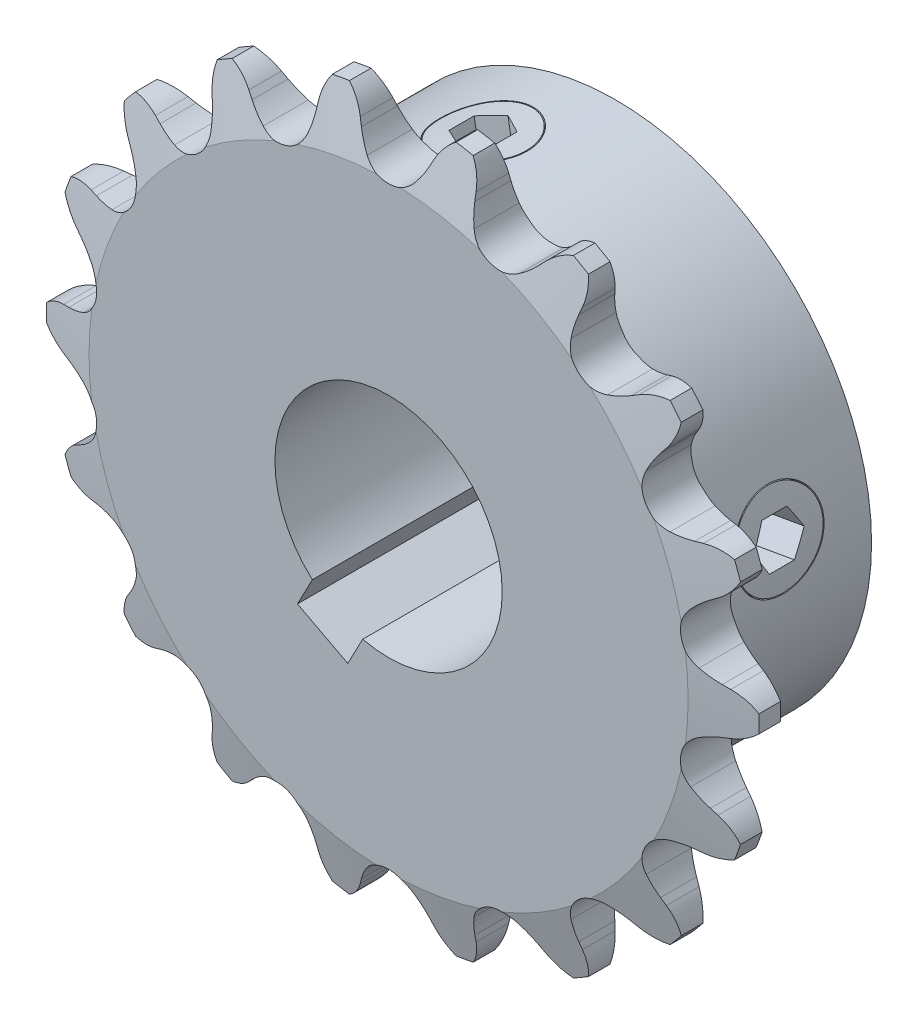
from build123d import *

# Parameters (mm, degrees)
TOOTH_CUT_NUMBER_OF_TEETH_18_DEPTH = 29.19349073
TOOTH_PATTERN_18_18_COUNT          = 18
SKETCH3_W                          = 9.906
SKETCH3_H                          = 14.2875
SKETCH4_R                          = 6.35
CUT_EXTRUDE1_DEPTH                 = 31.74639659
CUT_EXTRUDE2_DEPTH                 = 31.74639659
SKETCH7_R                          = 2.38125
CUT_EXTRUDE3_DEPTH                 = 37.850203716
CUT_EXTRUDE3_DRAFT                 = 1
EXTRUDE1_REACH                     = 38.85
EXTRUDE1_END_RADIUS                = 14.2875
SKETCH8_R                          = 2.431889526
CUT_EXTRUDE4_START                 = -1.27
CUT_EXTRUDE4_DEPTH                 = 36.580203747
CIRPATTERN1_START                  = 9.537857549
CIRPATTERN1_DEPTH                  = 4.749642451
EXTRUDE2_DEPTH                     = 12.7
CUT_EXTRUDE6_DEPTH                 = 31.74639659
CUT_EXTRUDE6_DEPTH_BACK            = 31.74639659


# Read off the part's stored shape, not the designer's step: CirPattern1
with BuildPart() as part:
    # Sprocket-BaseSketch → 25 (04C) ANSI (ISO) Chain Number, 1.440in P.D. (revolve)
    with BuildSketch(Plane(origin=(0, 0, 0), x_dir=(0, 0, -1), z_dir=(1, 0, 0)), mode=Mode.PRIVATE) as f_25_04c_ansi_iso_chain_number_1_440i_sk:
        Polygon((1.397, 0), (1.397, 16.736319777), (0.60325, 19.911319777), (-0.60325, 19.911319777), (-1.397, 16.736319777), (-1.397, 0), align=None)
    revolve(f_25_04c_ansi_iso_chain_number_1_440i_sk.sketch.rotate(Axis((0, 0, -5.588), (0, 0, 1)), 90), axis=Axis((0, 0, -5.588), (0, 0, 1)))

    # Tooth-Sketch → Tooth-Cut, Number of teeth: 18 (cut, symmetric)
    with BuildSketch(Plane.XY):
        with BuildLine():
            Line((1.908645709, 18.196215131), (2.066224101, 18.559583724))
            ThreePointArc((2.066224101, 18.559583724), (3.065556725, 19.747030253), (4.552569281, 20.191427162))
            ThreePointArc((4.552569281, 20.191427162), (0, 20.69829988), (-4.552569281, 20.191427162))
            ThreePointArc((-4.552569281, 20.191427162), (-3.065556725, 19.747030253), (-2.066224101, 18.559583724))
            Line((-2.066224101, 18.559583724), (-1.908645709, 18.196215131))
            ThreePointArc((-1.908645709, 18.196215131), (-1.651424634, 17.695000021), (-1.331431851, 17.231336472))
            ThreePointArc((-1.331431851, 17.231336472), (0, 16.586741284), (1.331431851, 17.231336472))
            ThreePointArc((1.331431851, 17.231336472), (1.651424634, 17.695000021), (1.908645709, 18.196215131))
        make_face()
    tooth_cut_number_of_teeth_18 = extrude(amount=TOOTH_CUT_NUMBER_OF_TEETH_18_DEPTH, both=True, mode=Mode.SUBTRACT)

    # Tooth Pattern, 18 / 18: Tooth-Cut, Number of teeth: 18 ×18 about axis
    tooth_pattern_18_18_axis = Axis((0, 0, 0), (0, 0, 1))
    for i in range(1, TOOTH_PATTERN_18_18_COUNT):
        add(tooth_cut_number_of_teeth_18.rotate(tooth_pattern_18_18_axis, i * 360 / TOOTH_PATTERN_18_18_COUNT), mode=Mode.SUBTRACT)

    # Sketch3 → Hub-Revolve1 (revolve)
    with BuildSketch(Plane(origin=(0, 0, 0), x_dir=(0, 0, -1), z_dir=(1, 0, 0)), mode=Mode.PRIVATE) as hub_revolve1_sk:
        with Locations((6.35, 7.14375)):
            Rectangle(SKETCH3_W, SKETCH3_H)
    revolve(hub_revolve1_sk.sketch.rotate(Axis((0, 0, 9.906), (0, 0, -1)), 90), axis=Axis((0, 0, 9.906), (0, 0, -1)))

    # Sketch4 → Cut-Extrude1 (cut, through all)
    with BuildSketch(Plane(origin=(0, 0, -11.303), x_dir=(-1, 0, 0), z_dir=(0, 0, -1))):
        Circle(SKETCH4_R)
    extrude(amount=-CUT_EXTRUDE1_DEPTH, mode=Mode.SUBTRACT)

    # Sketch6 → Cut-Extrude2 (cut, through all)
    with BuildSketch(Plane(origin=(0, 0, -11.303), x_dir=(-1, 0, 0), z_dir=(0, 0, -1))):
        Polygon((-1.322874788, 6.210676476), (-0.909375065, 8.555749938), (3.780771858, 7.728750492), (3.367272135, 5.38367703), align=None)
    extrude(amount=-CUT_EXTRUDE2_DEPTH, mode=Mode.SUBTRACT)


with BuildPart() as cut_extrude3_tool:
    # Sketch7 → Cut-Extrude3 (with draft: the straight prism first)
    with BuildSketch(Plane(origin=(-1.435698397, 8.142250215, 0), x_dir=(0.9848077530122081, 0.17364817766693008, 0), z_dir=(0.17364817766693008, -0.9848077530122081, 0))):
        with Locations((0, -6.35)):
            Circle(SKETCH7_R)
    extrude(amount=-CUT_EXTRUDE3_DEPTH)
    # Cut-Extrude3: the draft: its side faces are tilted about the plane it starts from
    cut_extrude3_sides = [cut_extrude3_tool.faces().sort_by_distance(p)[0] for p in [
        (-7.067081308, 26.366337528, -6.35),
    ]]
    draft(cut_extrude3_sides, Plane(origin=(-1.435698397, 8.142250215, 0), x_dir=(0.9848077530122081, 0.17364817766693008, 0), z_dir=(0.17364817766693008, -0.9848077530122081, 0)), CUT_EXTRUDE3_DRAFT)


with BuildPart() as part_1:
    add(part.part)

    # Cut-Extrude3: cut by cut_extrude3_tool
    add(cut_extrude3_tool.part, mode=Mode.SUBTRACT)

    # Extrude1: up to this cylinder (the profile starts inside it)
    extrude1_end = Plane(origin=(0, 0, -6.35), z_dir=(0, 0, 1)) * Cylinder(EXTRUDE1_END_RADIUS, 107.275, mode=Mode.PRIVATE)
    # Sketch8 → Extrude1 (add, up to the surface)
    with BuildSketch(Plane(origin=(-1.435698397, 8.142250215, 0), x_dir=(0.9848077530122081, 0.17364817766693008, 0), z_dir=(0.17364817766693008, -0.9848077530122081, 0)), mode=Mode.PRIVATE) as extrude1_sk1:
        with Locations((0, -6.35)):
            Circle(SKETCH8_R)
    extrude1_tool1 = extrude(extrude1_sk1.sketch, amount=-EXTRUDE1_REACH, mode=Mode.PRIVATE) & extrude1_end
    add(extrude1_tool1.solids().sort_by_distance((-1.435698, 8.14225, -6.35))[0])

    # Sketch9 → Cut-Extrude4 (cut, through all)
    with BuildSketch(Plane(origin=(-1.435698397, 8.142250215, 0), x_dir=(0.9848077530122081, 0.17364817766693008, 0), z_dir=(0.17364817766693008, -0.9848077530122081, 0)).offset(CUT_EXTRUDE4_START)):
        Polygon((0, -7.754052073), (1.215944763, -7.052026036), (1.215944763, -5.647973964), (0, -4.945947927), (-1.215944763, -5.647973964), (-1.215944763, -7.052026036), align=None)
    extrude(amount=-CUT_EXTRUDE4_DEPTH, mode=Mode.SUBTRACT)

    # CirPattern1 outline → CirPattern1 (cut)
    with BuildSketch(Plane(origin=(0, 0, 0), x_dir=(-0.173648177666927, 0.9848077530122086, 0), z_dir=(0.9848077530122088, 0.17364817766692697, 0)).offset(CIRPATTERN1_START)):
        Polygon((-1.215944763, -7.052026036), (0, -7.754052073), (1.215944763, -7.052026036), (1.215944763, -5.647973964), (0, -4.945947927), (-1.215944763, -5.647973964), align=None)
    extrude(amount=CIRPATTERN1_DEPTH, mode=Mode.SUBTRACT)

    # CirPattern1 2 outline → CirPattern1 2 (revolve, cut)
    with BuildSketch(Plane(origin=(0, 0, -6.35), x_dir=(-0.173648177666927, 0.9848077530122086, 0), z_dir=(0, 0, -1))):
        Polygon((2.431889526, 14.287530511), (2.431889526, 11.168994057), (2.48632489, 14.287593942), align=None)
    revolve(axis=Axis((0, 0, -6.35), (0.9848077530122086, 0.173648177666927, 0)), mode=Mode.SUBTRACT)

    # Sketch11 → Extrude2 (add, through all)
    with BuildSketch(Plane(origin=(0, 0, -11.303), x_dir=(-1, 0, 0), z_dir=(0, 0, -1))):
        with BuildLine():
            Line((-1.322874788, 6.210676476), (-0.909375065, 8.555749938))
            Line((-0.909375065, 8.555749938), (3.780771858, 7.728750492))
            Line((3.780771858, 7.728750492), (3.367272135, 5.38367703))
            ThreePointArc((3.367272135, 5.38367703), (1.102665928, 6.253529232), (-1.322874788, 6.210676476))
        make_face()
    extrude(amount=-EXTRUDE2_DEPTH)

    # Sketch15 → Cut-Extrude6 (cut, two sides: drawn at the far end of the back side and taken through both)
    with BuildSketch(Plane.XY.offset(1.397).offset(-CUT_EXTRUDE6_DEPTH_BACK)):
        with BuildLine():
            ThreePointArc((-1.447460154, -6.182827759), (-2.947204208, -5.624632198), (-4.259776253, -4.709225656))
            Line((-4.259776253, -4.709225656), (-5.090163309, -6.293989195))
            Line((-5.090163309, -6.293989195), (-2.27784721, -7.767591299))
            Line((-2.27784721, -7.767591299), (-1.447460154, -6.182827759))
        make_face()
    extrude(amount=CUT_EXTRUDE6_DEPTH + CUT_EXTRUDE6_DEPTH_BACK, mode=Mode.SUBTRACT)


solid = part_1.part
